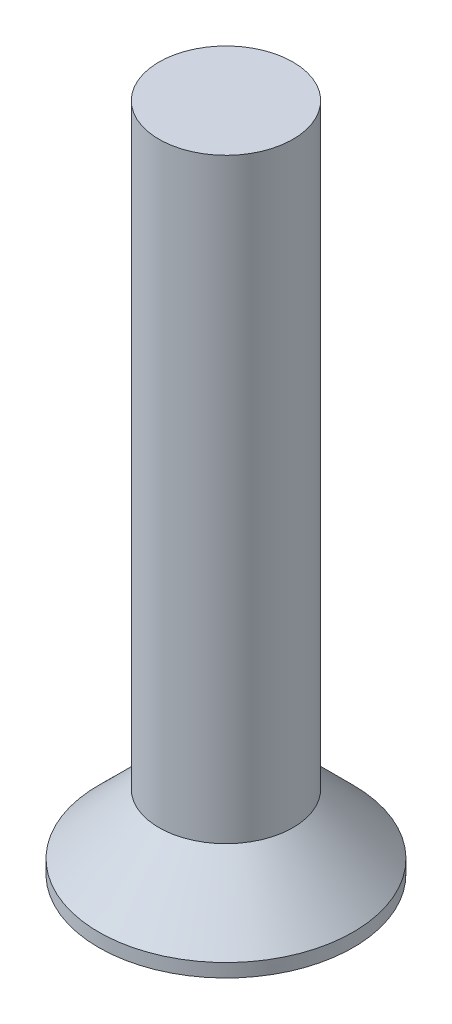
from build123d import *

# Parameters (mm, degrees)
SKETCH1_R           = 1.9
BOSS_EXTRUDE1_DEPTH = 1.3
SKETCH2_R           = 1
BOSS_EXTRUDE2_DEPTH = 10
CHAMFER1_SIZE       = 1.1
CUT_EXTRUDE1_DEPTH  = 0.3


with BuildPart() as part:
    # Sketch1 → Boss-Extrude1 (new body)
    with BuildSketch(Plane(origin=(0, 0, 0), x_dir=(1, 0, 0), z_dir=(0, 1, 0))):
        with Locations(Location((0, 0, 0), (0, 0, 270))):
            Circle(SKETCH1_R)
    extrude(amount=BOSS_EXTRUDE1_DEPTH)

    # Sketch2 → Boss-Extrude2 (add)
    with BuildSketch(Plane.XZ):
        with Locations(Location((0, 0, 0), (0, 0, 270))):
            Circle(SKETCH2_R)
    extrude(amount=-BOSS_EXTRUDE2_DEPTH)

    # Chamfer1
    # the kernel refuses this chamfer: 1.1 mm, written as the material it takes off along each edge
    with BuildSketch(Plane(origin=(0, 1.3, 0), x_dir=(0, 0, 1), z_dir=(-1, 0, 0))) as chamfer1_piece_1_section:
        Polygon((1.9, -CHAMFER1_SIZE), (1.9 - CHAMFER1_SIZE, 0), (1.9, 0), align=None)
    chamfer1_piece_1 = revolve(axis=Axis((0, 1.3, 0), (0, 1, 0)), mode=Mode.PRIVATE)
    chamfer1_piece_1 = chamfer1_piece_1 - Plane(origin=(0, 0.647474875, 0), x_dir=(0, 0, -1), z_dir=(0, -1, 0)) * Cylinder(1, 8, mode=Mode.PRIVATE)
    add(chamfer1_piece_1, mode=Mode.SUBTRACT)

    # Sketch3 → Cut-Extrude1 (cut)
    with BuildSketch(Plane.XZ):
        Polygon((-0.25, 1.5), (-0.25, 0.25), (-1.5, 0.25), (-1.5, -0.25), (-0.25, -0.25), (-0.25, -1.5), (0.25, -1.5), (0.25, -0.25), (1.5, -0.25), (1.5, 0.25), (0.25, 0.25), (0.25, 1.5), align=None)
    extrude(amount=-CUT_EXTRUDE1_DEPTH, mode=Mode.SUBTRACT)


solid = part.part
